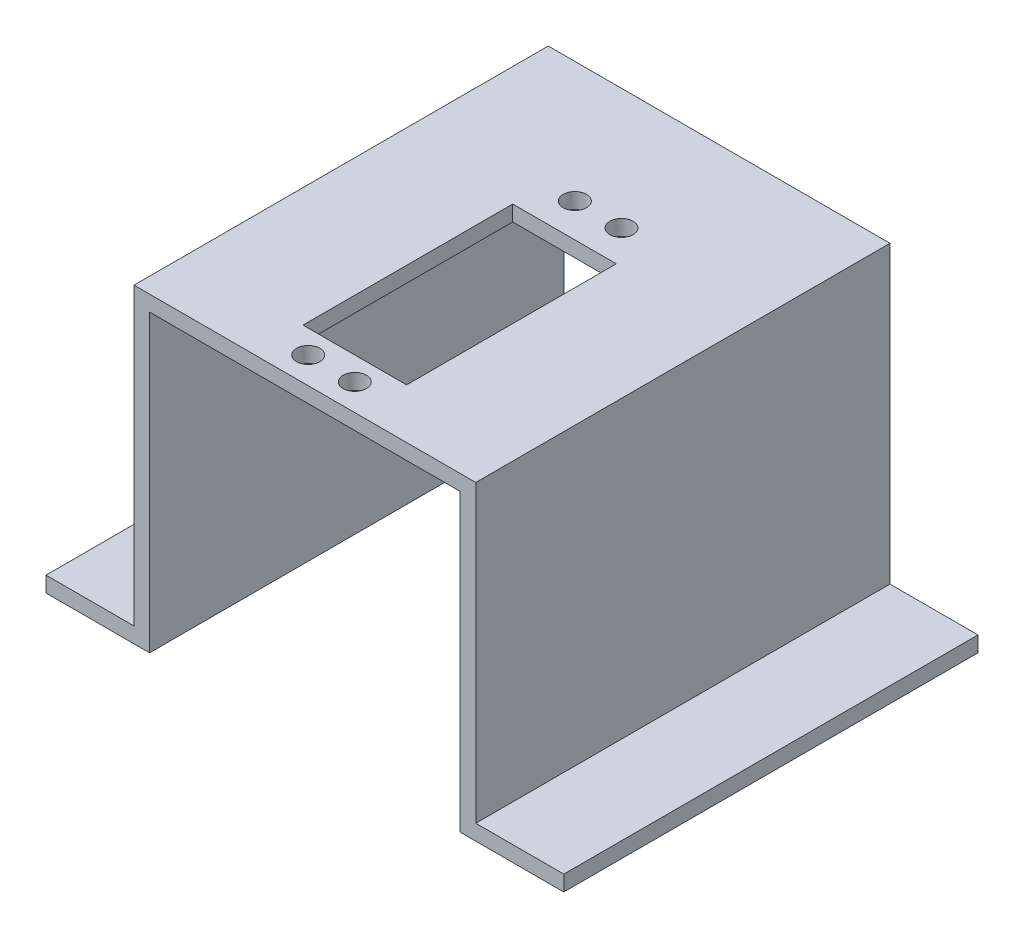
from build123d import *

# Parameters (mm, degrees)
SKETCH1_W           = 100
SKETCH1_H           = 80
BOSS_EXTRUDE1_DEPTH = 60
SKETCH2_W           = 17
SKETCH2_H           = 57
SKETCH2_W_2         = 60
CUT_EXTRUDE1_DEPTH  = 80
SKETCH3_W           = 20
SKETCH3_H           = 40.5
CUT_EXTRUDE2_DEPTH  = 3
SKETCH4_R           = 2.25
CUT_EXTRUDE3_DEPTH  = 3


with BuildPart() as part:
    # Sketch1 → Boss-Extrude1 (new body)
    with BuildSketch(Plane(origin=(0, 0, 0), x_dir=(1, 0, 0), z_dir=(0, 1, 0))):
        Rectangle(SKETCH1_W, SKETCH1_H)
    extrude(amount=BOSS_EXTRUDE1_DEPTH)

    # Sketch2 → Cut-Extrude1 (cut)
    with BuildSketch(Plane.XY.offset(40)):
        with Locations((-41.5, 31.5)):
            Rectangle(SKETCH2_W, SKETCH2_H)
        with Locations((0, 28.5)):
            Rectangle(SKETCH2_W_2, SKETCH2_H)
        with Locations((41.5, 31.5)):
            Rectangle(SKETCH2_W, SKETCH2_H)
    extrude(amount=-CUT_EXTRUDE1_DEPTH, mode=Mode.SUBTRACT)

    # Sketch3 → Cut-Extrude2 (cut)
    with BuildSketch(Plane(origin=(0, 60, 0), x_dir=(1, 0, 0), z_dir=(0, 1, 0))):
        with Locations((0, -10.11)):
            Rectangle(SKETCH3_W, SKETCH3_H)
    extrude(amount=-CUT_EXTRUDE2_DEPTH, mode=Mode.SUBTRACT)

    # Sketch4 → Cut-Extrude3 (cut)
    with BuildSketch(Plane(origin=(0, 60, 0), x_dir=(1, 0, 0), z_dir=(0, 1, 0))):
        with Locations((4.5, -34.86)):
            Circle(SKETCH4_R)
        with Locations((-4.5, -34.86)):
            Circle(SKETCH4_R)
        with Locations((-4.5, 16.64)):
            Circle(SKETCH4_R)
        with Locations((4.5, 16.64)):
            Circle(SKETCH4_R)
    extrude(amount=-CUT_EXTRUDE3_DEPTH, mode=Mode.SUBTRACT)


solid = part.part
